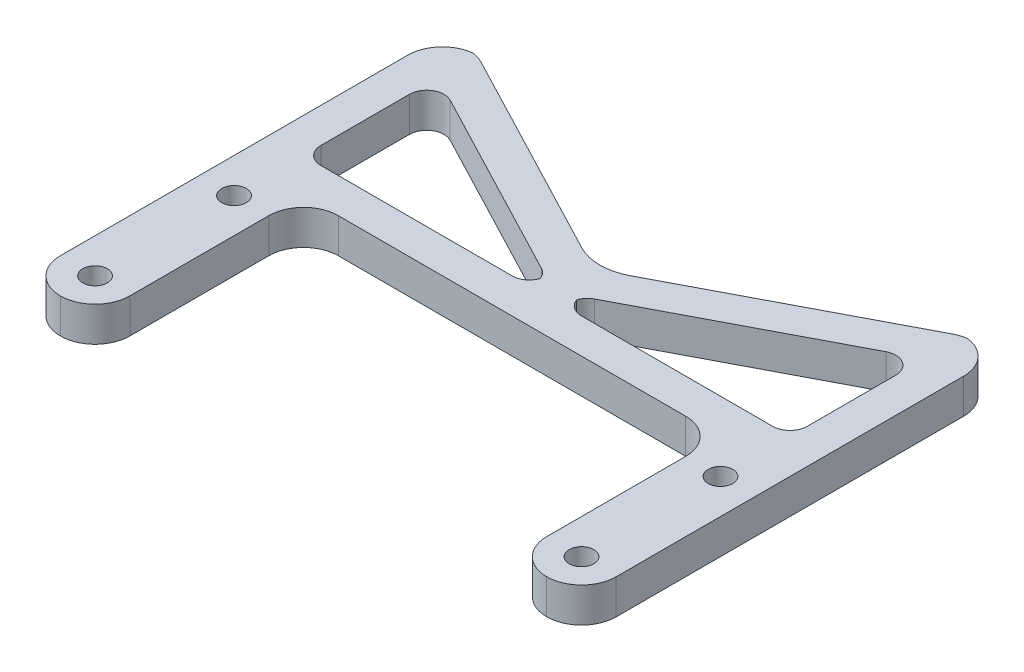
from build123d import *

# Parameters (mm, degrees)
SKETCH1_W          = 101.6
SKETCH1_H          = 76.2
BASE_DEPTH         = 6.35
TUBE_NOTCH_DEPTH   = 64.816710194
MOUNTING_HOLES_D   = 4.4958
SKETCH8_W          = 76.2
SKETCH8_H          = 38.1
WHEEL_CUTOUT_DEPTH = 64.816710194
FILLET1_R          = 6.35
FILLET2_R          = 9.525
CUT_EXTRUDE1_DEPTH = 64.816710194
FILLET3_R          = 3.175


with BuildPart() as part:
    # Sketch1 → Base (new body)
    with BuildSketch(Plane(origin=(0, 0, 0), x_dir=(1, 0, 0), z_dir=(0, 1, 0))):
        Rectangle(SKETCH1_W, SKETCH1_H)
    extrude(amount=BASE_DEPTH)

    # Sketch2 → Tube notch (cut, through all)
    with BuildSketch(Plane(origin=(0, 6.35, 0), x_dir=(1, 0, 0), z_dir=(0, 1, 0))):
        Polygon((-44.45, 38.1), (0, 14.855181866), (44.45, 38.1), align=None)
    extrude(amount=-TUBE_NOTCH_DEPTH, mode=Mode.SUBTRACT)

    # Mounting holes (through all)
    with Locations(Plane(origin=(0, 6.35, 0), x_dir=(1, 0, 0), z_dir=(0, 1, 0))):
        with Locations((-44.45, -6.35), (-44.45, -31.75), (44.45, -31.75), (44.45, -6.35)):
            Hole(MOUNTING_HOLES_D / 2)

    # Sketch8 → Wheel cutout (cut, through all)
    with BuildSketch(Plane(origin=(0, 6.35, 0), x_dir=(1, 0, 0), z_dir=(0, 1, 0))):
        with Locations((0, -19.05)):
            Rectangle(SKETCH8_W, SKETCH8_H)
    extrude(amount=-WHEEL_CUTOUT_DEPTH, mode=Mode.SUBTRACT)

    # Fillet1
    # the kernel refuses this fillet: 6.35 mm, written as the material it adds along each edge
    with BuildSketch(Plane(origin=(38.1, 6.35, 0), x_dir=(0, 0, 1), z_dir=(0, -1, 0))) as fillet1_piece_1:
        with BuildLine():
            CenterArc((FILLET1_R, FILLET1_R), FILLET1_R, 180, 90)
            Line((0, FILLET1_R), (0, 0))
            Line((0, 0), (FILLET1_R, 0))
        make_face()
    extrude(amount=6.35)
    with BuildSketch(Plane(origin=(-38.1, 6.35, 0), x_dir=(0, 0, 1), z_dir=(0, -1, 0))) as fillet1_piece_2:
        with BuildLine():
            CenterArc((FILLET1_R, -FILLET1_R), FILLET1_R, 90, 90)
            Line((0, -FILLET1_R), (0, 0))
            Line((0, 0), (FILLET1_R, 0))
        make_face()
    extrude(amount=6.35)
    # the kernel refuses this fillet: 6.35 mm, written as the material it takes off along each edge
    with BuildSketch(Plane(origin=(-50.8, -15.875, 38.1), x_dir=(1, 0, 0), z_dir=(0, 1, 0)), Plane(origin=(50.8, -15.875, -38.1), x_dir=(-1, 0, 0), z_dir=(0, 1, 0)), Plane(origin=(50.8, -15.875, 38.1), x_dir=(0, 0, -1), z_dir=(0, 1, 0)), Plane(origin=(-38.1, 22.225, 38.1), x_dir=(-1, 0, 0), z_dir=(0, -1, 0)), Plane(origin=(-50.8, -15.875, -38.1), x_dir=(0, 0, 1), z_dir=(0, 1, 0))) as fillet1_2_piece_1:
        with BuildLine():
            CenterArc((FILLET1_R, FILLET1_R), FILLET1_R, 180, 90)
            Line((0, FILLET1_R), (0, 0))
            Line((0, 0), (FILLET1_R, 0))
        make_face()
    extrude(amount=38.1, mode=Mode.SUBTRACT)
    with BuildSketch(Plane(origin=(-44.45, 10.250302923, -38.1), x_dir=(-1, 0, 0), z_dir=(0, -1, 0)), Plane(origin=(44.45, 10.250302923, -38.1), x_dir=(-0.8861469338573508, 0, 0.46340437159700587), z_dir=(0, -1, 0))) as fillet1_2_piece_2:
        with BuildLine():
            CenterArc((FILLET1_R * 0.245688373095, -FILLET1_R), FILLET1_R, 90, 27.607004509)
            Line((-FILLET1_R * 0.217715998502, -FILLET1_R * 0.113853066143), (0, 0))
            Line((0, 0), (FILLET1_R * 0.245688373095, 0))
        make_face()
    extrude(amount=14.150605846, mode=Mode.SUBTRACT)
    with BuildSketch(Plane(origin=(38.1, 22.225, 38.1), x_dir=(1, 0, 0), z_dir=(0, -1, 0))) as fillet1_2_piece_3:
        with BuildLine():
            CenterArc((FILLET1_R, -FILLET1_R), FILLET1_R, 90, 90)
            Line((0, -FILLET1_R), (0, 0))
            Line((0, 0), (FILLET1_R, 0))
        make_face()
    extrude(amount=38.1, mode=Mode.SUBTRACT)

    # Fillet2
    fillet2_edges = [part.edges().sort_by_distance(p)[0] for p in [
        (0, 3.175, -14.855181866),
    ]]
    fillet(fillet2_edges, radius=FILLET2_R)

    # Sketch9 → Cut-Extrude1 (cut, through all)
    with BuildSketch(Plane(origin=(0, 6.35, 0), x_dir=(1, 0, 0), z_dir=(0, 1, 0))):
        Polygon((-44.45, 6.35), (-44.45, 30.934145493), (-3.175, 9.349671511), (-3.175, 6.35), align=None)
        Polygon((3.175, 9.349671511), (44.45, 30.934145493), (44.45, 6.35), (3.175, 6.35), align=None)
    extrude(amount=-CUT_EXTRUDE1_DEPTH, mode=Mode.SUBTRACT)

    # Fillet3
    # the kernel refuses this fillet: 3.175 mm, written as the material it adds along each edge
    with BuildSketch(Plane(origin=(-44.45, 6.35, -6.35), x_dir=(1, 0, 0), z_dir=(0, -1, 0))) as fillet3_piece_1:
        with BuildLine():
            CenterArc((FILLET3_R, -FILLET3_R), FILLET3_R, 90, 90)
            Line((0, -FILLET3_R), (0, 0))
            Line((0, 0), (FILLET3_R, 0))
        make_face()
    extrude(amount=6.35)
    with BuildSketch(Plane(origin=(-3.175, 6.35, -9.349671511), x_dir=(0, 0, 1), z_dir=(0, -1, 0))) as fillet3_piece_2:
        with BuildLine():
            CenterArc((FILLET3_R * 0.605537984618, FILLET3_R), FILLET3_R, 207.607004509, 62.392995491)
            Line((-FILLET3_R * 0.28060894924, FILLET3_R * 0.536595628403), (0, 0))
            Line((0, 0), (FILLET3_R * 0.605537984618, 0))
        make_face()
    extrude(amount=6.35)
    with BuildSketch(Plane(origin=(-3.175, 6.35, -6.35), x_dir=(-1, 0, 0), z_dir=(0, -1, 0)), Plane(origin=(44.45, 6.35, -6.35), x_dir=(-1, 0, 0), z_dir=(0, -1, 0)), Plane(origin=(3.175, 6.35, -6.35), x_dir=(0, 0, -1), z_dir=(0, -1, 0))) as fillet3_piece_3:
        with BuildLine():
            CenterArc((FILLET3_R, FILLET3_R), FILLET3_R, 180, 90)
            Line((0, FILLET3_R), (0, 0))
            Line((0, 0), (FILLET3_R, 0))
        make_face()
    extrude(amount=6.35)
    with BuildSketch(Plane(origin=(3.175, 6.35, -9.349671511), x_dir=(0, 0, 1), z_dir=(0, -1, 0))) as fillet3_piece_4:
        with BuildLine():
            CenterArc((FILLET3_R * 0.605537984618, -FILLET3_R), FILLET3_R, 90, 62.392995491)
            Line((-FILLET3_R * 0.28060894924, -FILLET3_R * 0.536595628403), (0, 0))
            Line((0, 0), (FILLET3_R * 0.605537984618, 0))
        make_face()
    extrude(amount=6.35)
    with BuildSketch(Plane(origin=(44.45, 6.35, -30.934145493), x_dir=(0, 0, 1), z_dir=(0, -1, 0)), Plane(origin=(-44.45, 6.35, -30.934145493), x_dir=(0.8861469338573508, 0, 0.463404371597006), z_dir=(0, -1, 0))) as fillet3_piece_5:
        with BuildLine():
            CenterArc((FILLET3_R * 1.65142406489, FILLET3_R), FILLET3_R, 152.392995491, 117.607004509)
            Line((FILLET3_R * 0.765277131029, FILLET3_R * 1.4634043716), (0, 0))
            Line((0, 0), (FILLET3_R * 1.65142406489, 0))
        make_face()
    extrude(amount=6.35)


solid = part.part
